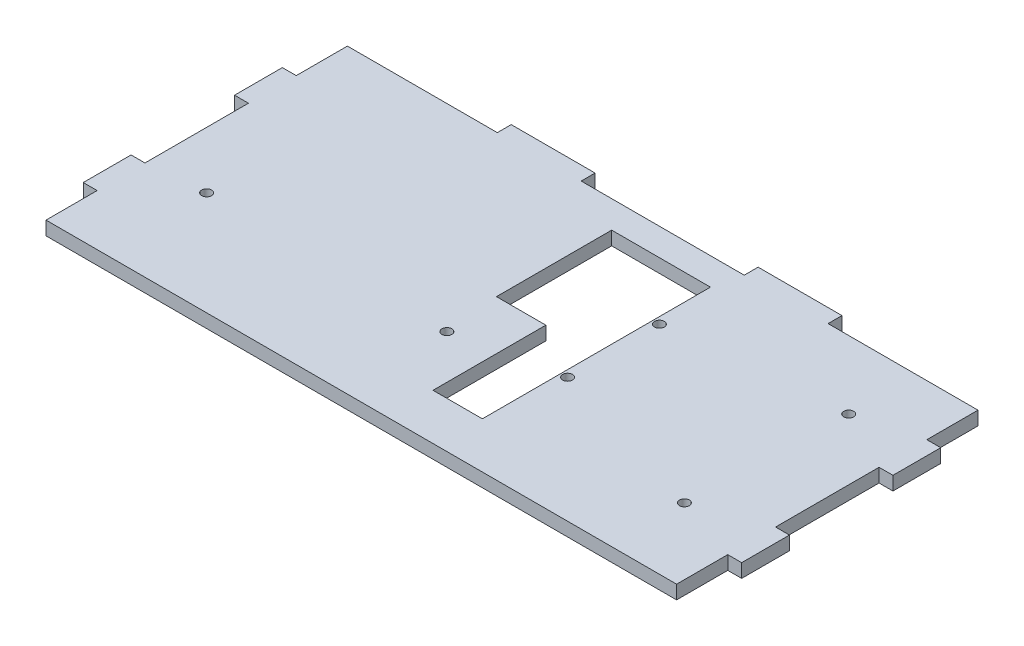
from build123d import *

# Parameters (mm, degrees)
SKETCH1_W           = 200
SKETCH1_H           = 100
BOSS_EXTRUDE1_DEPTH = 4.15
SKETCH13_W          = 49.52
SKETCH13_H          = 4.22
SKETCH13_W_2        = 4.22
SKETCH13_H_2        = 31.44
SKETCH13_H_3        = 19.76
CUT_EXTRUDE12_DEPTH = 10
SKETCH14_W          = 191.8
SKETCH14_H          = 4.22
CUT_EXTRUDE13_DEPTH = 10
CUT_EXTRUDE18_DEPTH = 10
SKETCH22_R          = 1.5
CUT_EXTRUDE23_DEPTH = 10
SKETCH25_R          = 1.5
CUT_EXTRUDE27_DEPTH = 10


with BuildPart() as part:
    # Sketch1 → Boss-Extrude1 (new body)
    with BuildSketch(Plane(origin=(0, 0, 0), x_dir=(1, 0, 0), z_dir=(0, 1, 0))):
        Rectangle(SKETCH1_W, SKETCH1_H)
    extrude(amount=BOSS_EXTRUDE1_DEPTH)

    # Sketch13 → Cut-Extrude12 (cut)
    with BuildSketch(Plane(origin=(0, 4.15, 0), x_dir=(1, 0, 0), z_dir=(0, 1, 0))):
        with Locations((0, 47.89)):
            Rectangle(SKETCH13_W, SKETCH13_H)
        Polygon((-100, 50), (-50.24, 50), (-50.24, 45.78), (-95.78, 45.78), (-95.78, 30.24), (-100, 30.24), align=None)
        Polygon((95.78, 45.78), (50.24, 45.78), (50.24, 50), (100, 50), (100, 30.24), (95.78, 30.24), align=None)
        with Locations((-97.89, 0)):
            Rectangle(SKETCH13_W_2, SKETCH13_H_2)
        with Locations((-97.89, -40.12)):
            Rectangle(SKETCH13_W_2, SKETCH13_H_3)
        with Locations((97.89, 0)):
            Rectangle(SKETCH13_W_2, SKETCH13_H_2)
        with Locations((97.89, -40.12)):
            Rectangle(SKETCH13_W_2, SKETCH13_H_3)
    extrude(amount=-CUT_EXTRUDE12_DEPTH, mode=Mode.SUBTRACT)

    # Sketch14 → Cut-Extrude13 (cut)
    with BuildSketch(Plane(origin=(0, 4.15, 0), x_dir=(1, 0, 0), z_dir=(0, 1, 0))):
        with Locations((-0.12, -47.89)):
            Rectangle(SKETCH14_W, SKETCH14_H)
    extrude(amount=-CUT_EXTRUDE13_DEPTH, mode=Mode.SUBTRACT)

    # Sketch18 → Cut-Extrude18 (cut)
    with BuildSketch(Plane(origin=(0, 4.15, 0), x_dir=(1, 0, 0), z_dir=(0, 1, 0))):
        Polygon((12.78, 37.5), (22.78, 37.5), (22.78, -31.78), (7.78, -31.78), (7.78, 2.5), (-7.22, 2.5), (-7.22, 37.5), align=None)
    extrude(amount=-CUT_EXTRUDE18_DEPTH, mode=Mode.SUBTRACT)

    # Sketch22 → Cut-Extrude23 (cut)
    with BuildSketch(Plane(origin=(0, 4.15, 0), x_dir=(1, 0, 0), z_dir=(0, 1, 0))):
        with Locations((-78.55, -14.22)):
            Circle(SKETCH22_R)
        with Locations((-5.55, -14.22)):
            Circle(SKETCH22_R)
    extrude(amount=-CUT_EXTRUDE23_DEPTH, mode=Mode.SUBTRACT)

    # Sketch25 → Cut-Extrude27 (cut)
    with BuildSketch(Plane(origin=(0, 4.15, 0), x_dir=(1, 0, 0), z_dir=(0, 1, 0))):
        with Locations((24.78, 20)):
            Circle(SKETCH25_R)
        with Locations((24.78, -7.9)):
            Circle(SKETCH25_R)
        with Locations((77.18, 25.1)):
            Circle(SKETCH25_R)
        with Locations((75.58, -23.2)):
            Circle(SKETCH25_R)
    extrude(amount=-CUT_EXTRUDE27_DEPTH, mode=Mode.SUBTRACT)


solid = part.part
